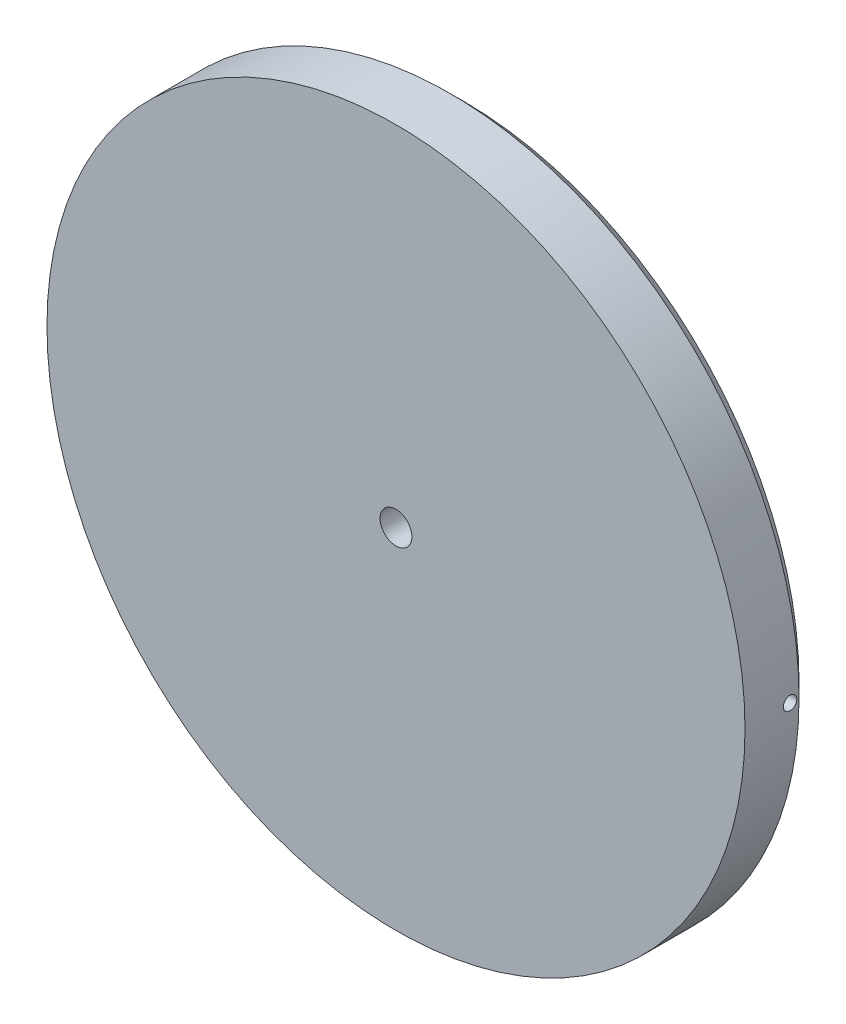
from build123d import *

# Parameters (mm, degrees)
BOSS_EXTRUDE1_DEPTH             = 10
BOSS_EXTRUDE1_DEPTH_BACK        = 5
SKETCH1_R                       = 77.5
SKETCH1_R_2                     = 3.535
SKETCH2_R                       = 1.5
CUT_EXTRUDE1_DEPTH              = 111.056803515
SKETCH3_R                       = 1.5
CUT_EXTRUDE2_DEPTH              = 111.056803668
CHAMFER1_SIZE                   = 3
BOSS_EXTRUDE2_REACH             = 112.057
SKETCH4_R                       = 71.5
SKETCH4_R_2                     = 3.535
BOSS_EXTRUDE2_DIRECTION_2_REACH = 112.057


with BuildPart() as part:
    # Sketch1 → Boss-Extrude1 (new, two sides: drawn at the far end of the back side and taken through both)
    with BuildSketch(Plane.XY.offset(-BOSS_EXTRUDE1_DEPTH_BACK)):
        Circle(SKETCH1_R)
        Circle(SKETCH1_R_2, mode=Mode.SUBTRACT)
    extrude(amount=BOSS_EXTRUDE1_DEPTH + BOSS_EXTRUDE1_DEPTH_BACK)

    # Sketch2 → Cut-Extrude1 (cut, through all)
    with BuildSketch(Plane(origin=(0, 0, 0), x_dir=(1, 0, 0), z_dir=(0, 1, 0))):
        Circle(SKETCH2_R)
    extrude(amount=-CUT_EXTRUDE1_DEPTH, mode=Mode.SUBTRACT)

    # Sketch3 → Cut-Extrude2 (cut, through all)
    with BuildSketch(Plane(origin=(0, 0, 0), x_dir=(0, 0, -1), z_dir=(1, 0, 0))):
        Circle(SKETCH3_R)
    extrude(amount=CUT_EXTRUDE2_DEPTH, mode=Mode.SUBTRACT)

    # Chamfer1
    chamfer1_edges = [part.edges().sort_by_distance(p)[0] for p in [
        (-77.5, 0, -5),
    ]]
    chamfer(chamfer1_edges, length=CHAMFER1_SIZE)

    # Boss-Extrude2: up to this face of the body (flat: up to its plane)
    boss_extrude2_end = Plane(part.part.faces().sort_by_distance((-75.307968978, 0, 10))[0])
    # Sketch4 → Boss-Extrude2 (add, up to the picked face)
    with BuildSketch(Plane.XY, mode=Mode.PRIVATE) as boss_extrude2_sk1:
        Circle(SKETCH4_R)
        Circle(SKETCH4_R_2, mode=Mode.SUBTRACT)
    boss_extrude2_tool1 = split(extrude(boss_extrude2_sk1.sketch, amount=BOSS_EXTRUDE2_REACH, mode=Mode.PRIVATE), bisect_by=boss_extrude2_end, keep=Keep.BOTH, mode=Mode.PRIVATE)
    add(boss_extrude2_tool1.solids().sort_by(Axis((-69.477675, 0, 0), (0, 0, 1)))[0])

    # Boss-Extrude2 direction 2: up to this face of the body (flat: up to its plane)
    boss_extrude2_direction_2_end = Plane(part.part.faces().sort_by_distance((-72.392821792, 0, -5))[0])
    # Sketch4 → Boss-Extrude2 direction 2 (add, up to the picked face)
    with BuildSketch(Plane.XY, mode=Mode.PRIVATE) as boss_extrude2_direction_2_sk1:
        Circle(SKETCH4_R)
        Circle(SKETCH4_R_2, mode=Mode.SUBTRACT)
    boss_extrude2_direction_2_tool1 = split(extrude(boss_extrude2_direction_2_sk1.sketch, amount=-BOSS_EXTRUDE2_DIRECTION_2_REACH, mode=Mode.PRIVATE), bisect_by=boss_extrude2_direction_2_end, keep=Keep.BOTH, mode=Mode.PRIVATE)
    add(boss_extrude2_direction_2_tool1.solids().sort_by(Axis((-69.477675, 0, 0), (0, 0, -1)))[0])


solid = part.part
